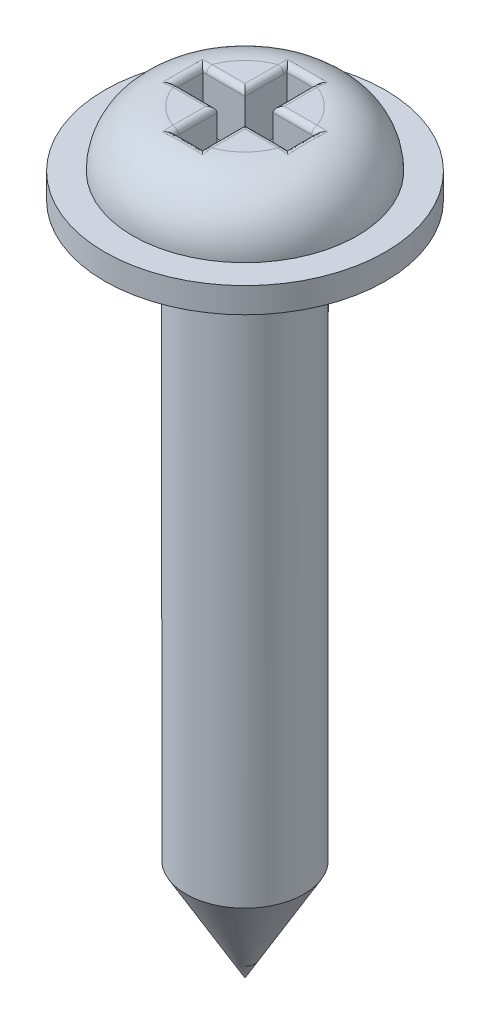
from build123d import *

# Parameters (mm, degrees)
SKETCH1_R           = 2.5
BOSS_EXTRUDE1_DEPTH = 0.45
SKETCH3_R           = 2
BOSS_EXTRUDE2_DEPTH = 1
FILLET1_R           = 1
CUT_EXTRUDE1_DEPTH  = 1
FILLET2_R           = 0.1
SKETCH5_R           = 1.05
BOSS_EXTRUDE3_DEPTH = 12
CHAMFER1_SIZE       = 1.05
CHAMFER1_SIZE2      = 1.818653348


with BuildPart() as part:
    # Sketch1 → Boss-Extrude1 (new body)
    with BuildSketch(Plane(origin=(0, 0, 0), x_dir=(1, 0, 0), z_dir=(0, 1, 0))):
        with Locations(Location((0, 0, 0), (0, 0, 270))):
            Circle(SKETCH1_R)
    extrude(amount=BOSS_EXTRUDE1_DEPTH)

    # Sketch3 → Boss-Extrude2 (add)
    with BuildSketch(Plane(origin=(0, 0.45, 0), x_dir=(1, 0, 0), z_dir=(0, 1, 0))):
        with Locations(Location((0, 0, 0), (0, 0, 270))):
            Circle(SKETCH3_R)
    extrude(amount=BOSS_EXTRUDE2_DEPTH)

    # Fillet1
    fillet1_edges = [part.edges().sort_by_distance(p)[0] for p in [
        (0, 1.45, -2),
    ]]
    fillet(fillet1_edges, radius=FILLET1_R - 0.0001)  # a hair under: the kernel refuses the full size

    # Sketch4 → Cut-Extrude1 (cut)
    with BuildSketch(Plane(origin=(0, 1.45, 0), x_dir=(1, 0, 0), z_dir=(0, 1, 0))):
        Polygon((-1, -0.25), (-0.25, -0.25), (-0.25, -1), (0.25, -1), (0.25, -0.25), (1, -0.25), (1, 0.25), (0.25, 0.25), (0.25, 1), (-0.25, 1), (-0.25, 0.25), (-1, 0.25), align=None)
    extrude(amount=-CUT_EXTRUDE1_DEPTH, mode=Mode.SUBTRACT)

    # Fillet2
    fillet2_edges = [part.edges().sort_by_distance(p)[0] for p in [
        (-0.98417631, 1.449882438, 0.25),
        (-1, 1.45, 0),
        (-0.98417631, 1.449882438, -0.25),
        (-0.25, 1.449882438, 0.98417631),
        (0, 1.45, 1),
        (0.25, 1.449882438, 0.98417631),
        (0.98417631, 1.449882438, 0.25),
        (1, 1.45, 0),
        (0.98417631, 1.449882438, -0.25),
        (0.25, 1.449882438, -0.98417631),
        (0, 1.45, -1),
        (-0.25, 1.449882438, -0.98417631),
        (-0.609174558, 1.45, 0.25),
        (-0.25, 1.45, 0.609174558),
        (0.25, 1.45, 0.609174558),
        (0.609174558, 1.45, 0.25),
        (0.609174558, 1.45, -0.25),
        (0.25, 1.45, -0.609174558),
        (-0.25, 1.45, -0.609174558),
        (-0.609174558, 1.45, -0.25),
    ]]
    fillet(fillet2_edges, radius=FILLET2_R)

    # Sketch5 → Boss-Extrude3 (add)
    with BuildSketch(Plane.XZ):
        with Locations(Location((0, 0, 0), (0, 0, 270))):
            Circle(SKETCH5_R)
    extrude(amount=BOSS_EXTRUDE3_DEPTH)

    # Chamfer1
    chamfer1_edges = [part.edges().sort_by_distance(p)[0] for p in [
        (0, -12, 1.05),
    ]]
    chamfer1_side = [part.faces().sort_by_distance(p)[0] for p in [
        (0, -12, 0),
    ]]
    chamfer(chamfer1_edges, length=CHAMFER1_SIZE, length2=CHAMFER1_SIZE2, reference=chamfer1_side[0])


solid = part.part
